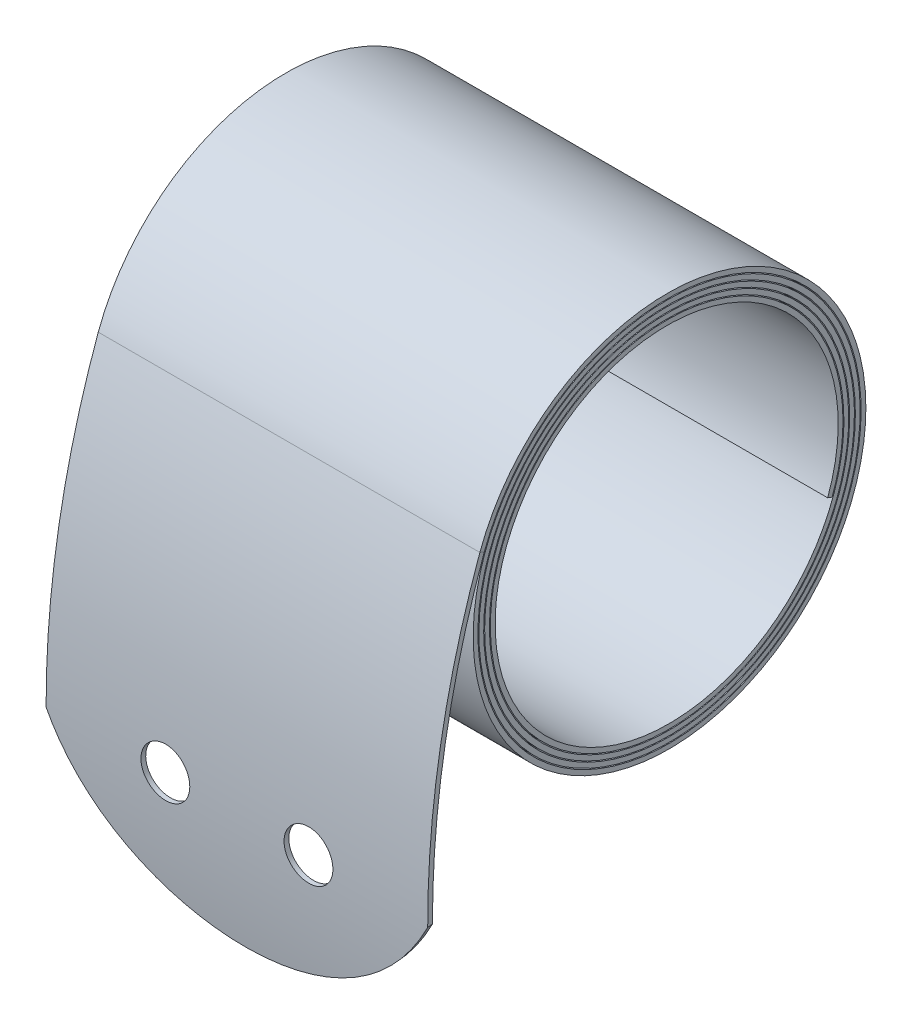
from build123d import *

# Parameters (mm, degrees)
SWEEP1_START            = -25.4
SWEEP1_DEPTH            = 50.8
CUT_EXTRUDE1_START      = -32.004
SKETCH7_R               = 3.2512
CUT_EXTRUDE1_DEPTH      = 0.681175
CUT_EXTRUDE2_REACH      = 81.314
CUT_EXTRUDE2_END_RADIUS = 114.481887753


# Read off the part's stored shape, not the designer's step: Sweep1
with BuildPart() as part:
    # Sweep1 outline → Sweep1 (new body)
    with BuildSketch(Plane.YZ.offset(SWEEP1_START)):
        with BuildLine():
            add(Edge.make_bspline(
                [(8.903137724, 24.465391141), (10.700868747, 23.801683687), (12.424511347, 22.938788454), (16.844541654, 20.077476403), (19.297827534, 17.707835933), (23.129543349, 12.223133684), (24.505684338, 9.109523574), (25.983668908, 2.59633953), (26.084861672, -0.800173821), (24.999673041, -7.377666567), (23.814808706, -10.556407395), (20.337047387, -16.22878679), (18.044903236, -18.721294308), (12.694684995, -22.657644037), (9.637997127, -24.099180397), (3.209844587, -25.724504821), (-0.15859242, -25.907571307), (-6.71284624, -24.990609709), (-9.896404372, -23.892031774), (-15.610508884, -20.578578721), (-18.139923082, -18.364418644), (-22.176631417, -13.150492998), (-23.681604623, -10.152048253), (-25.450992962, -3.812207553), (-25.714616983, -0.473804723), (-24.964084289, 6.052944065), (-23.951310748, 9.239013154), (-20.802104637, 14.990220244), (-18.666349722, 17.55422609), (-13.590396859, 21.686992551), (-10.651454439, 23.25341896), (-4.403096531, 25.163523714), (-1.09663805, 25.506342667), (5.398413944, 24.920333403), (8.584714317, 23.992821371), (14.368429935, 21.007673594), (16.964714197, 18.950678553), (21.189216843, 14.01425013), (22.815089545, 11.136007128), (24.862495039, 4.982192063), (25.283101453, 1.709539351), (24.859605366, -4.749701113), (24.016752103, -7.933981359), (21.195348133, -13.745643394), (19.217401652, -16.371896492), (14.421920767, -20.683795633), (11.605511793, -22.367086297), (5.5491873, -24.548312104), (2.312151981, -25.045255211), (-4.107241841, -24.782159903), (-7.287280367, -24.023303873), (-13.122362044, -21.365204732), (-15.776279894, -19.46652987), (-20.171221783, -14.813291139), (-21.90988251, -12.059787994), (-24.2213869, -6.103788165), (-24.793174231, -2.904131072), (-24.688267859, 3.47146314), (-24.012689834, 6.645069692), (-21.51733364, 12.499082915), (-19.698088278, 15.17836875), (-15.188258015, 19.651989265), (-12.498669425, 21.443954445), (-6.645713494, 23.882137863), (-3.485143725, 24.527236864), (2.842782484, 24.578210899), (6.007799632, 23.985135102), (11.876298275, 21.651838714), (14.57866445, 19.912116051), (19.126592756, 15.546732552), (20.969780926, 12.922003952), (23.530989486, 7.174695183), (24.247829157, 4.054869198), (24.452281203, -2.221607538), (23.940876488, -5.375912123), (21.76883723, -11.254495262), (20.108666337, -13.977665036), (15.888640263, -18.595527226), (13.329653632, -20.487842928), (7.690478305, -23.168371932), (4.612999083, -23.955344486), (-1.608335891, -24.310781156), (-4.749840436, -23.880162221), (-10.634155519, -21.868459702), (-13.375864819, -20.287806109), (-18.059287537, -16.21392098), (-19.998623169, -13.72149473), (-22.794720642, -8.192821232), (-23.650183182, -5.159237469), (-24.154023026, 1.003354808), (-23.803251669, 4.130008885), (-21.950849674, 10.015754847), (-20.449616024, 12.773754006), (-16.522528795, 17.518368034), (-14.097417718, 19.502605709), (-8.681495737, 22.410475943), (-5.693301097, 23.332752155), (0.407040981, 23.982328643), (3.516832544, 23.710415046), (9.399762849, 22.016163517), (12.171818322, 20.594190248), (16.97326215, 16.814432007), (19.000275539, 14.457327266), (22.016082652, 9.156287084), (23.003464514, 6.214919501), (23.796029065, 0.180239702), (23.601933114, -2.910716972), (22.064570208, -8.786642595), (20.721636296, -11.570538649), (17.089613041, -16.424462003), (14.801142218, -18.492118178), (9.616994114, -21.611989681), (6.723835142, -22.662739187), (0.758132384, -23.595464243), (-2.312057945, -23.478096881), (-8.176850283, -22.096251102), (-10.97039066, -20.832074841), (-15.872458002, -17.348068366), (-17.97861927, -15.128795563), (-21.198649639, -10.06342931), (-22.311000533, -7.21980353), (-23.380982678, -1.326293449), (-23.339207286, 1.721241201), (-22.111399698, 7.570834914), (-20.925639525, 10.371844468), (-17.5898084, 15.317738459), (-15.440234387, 17.460264188), (-10.49541886, 20.776518431), (-7.70259333, 21.948677955), (-1.884390732, 23.152941076), (1.13864219, 23.185574885), (6.969037975, 22.110221394), (9.775364276, 21.002476761), (14.760789197, 17.8148574), (16.937537627, 15.73541982), (20.346054864, 10.912802703), (21.57620551, 8.171986465), (22.911703992, 2.432103709), (23.017519524, -0.564625841), (22.092933231, -6.371893121), (21.062745519, -9.181408033), (18.023253351, -14.202093166), (16.014326971, -16.410923215), (11.315434562, -19.90772024), (8.6277782, -21.194021522), (2.969123682, -22.65764348), (0.000453671, -22.835370014), (-4.541194543, -22.225965003), (-6.167621007, -21.821223556), (-7.728596637, -21.243832796)],
                knots=[1.961e-06, 1.961e-06, 1.961e-06, 1.961e-06, 0.0078125, 0.0078125, 0.021484375, 0.021484375, 0.03515625, 0.03515625, 0.048828125, 0.048828125, 0.0625, 0.0625, 0.076171875, 0.076171875, 0.08984375, 0.08984375, 0.103515625, 0.103515625, 0.1171875, 0.1171875, 0.130859375, 0.130859375, 0.14453125, 0.14453125, 0.158203125, 0.158203125, 0.171875, 0.171875, 0.185546875, 0.185546875, 0.19921875, 0.19921875, 0.212890625, 0.212890625, 0.2265625, 0.2265625, 0.240234375, 0.240234375, 0.25390625, 0.25390625, 0.267578125, 0.267578125, 0.28125, 0.28125, 0.294921875, 0.294921875, 0.30859375, 0.30859375, 0.322265625, 0.322265625, 0.3359375, 0.3359375, 0.349609375, 0.349609375, 0.36328125, 0.36328125, 0.376953125, 0.376953125, 0.390625, 0.390625, 0.404296875, 0.404296875, 0.41796875, 0.41796875, 0.431640625, 0.431640625, 0.4453125, 0.4453125, 0.458984375, 0.458984375, 0.47265625, 0.47265625, 0.486328125, 0.486328125, 0.5, 0.5, 0.513671875, 0.513671875, 0.52734375, 0.52734375, 0.541015625, 0.541015625, 0.5546875, 0.5546875, 0.568359375, 0.568359375, 0.58203125, 0.58203125, 0.595703125, 0.595703125, 0.609375, 0.609375, 0.623046875, 0.623046875, 0.63671875, 0.63671875, 0.650390625, 0.650390625, 0.6640625, 0.6640625, 0.677734375, 0.677734375, 0.69140625, 0.69140625, 0.705078125, 0.705078125, 0.71875, 0.71875, 0.732421875, 0.732421875, 0.74609375, 0.74609375, 0.759765625, 0.759765625, 0.7734375, 0.7734375, 0.787109375, 0.787109375, 0.80078125, 0.80078125, 0.814453125, 0.814453125, 0.828125, 0.828125, 0.841796875, 0.841796875, 0.85546875, 0.85546875, 0.869140625, 0.869140625, 0.8828125, 0.8828125, 0.896484375, 0.896484375, 0.91015625, 0.91015625, 0.923828125, 0.923828125, 0.9375, 0.9375, 0.951171875, 0.951171875, 0.96484375, 0.96484375, 0.978515625, 0.978515625, 0.9921875, 0.9921875, 1, 1, 1, 1], degree=3))
            Line((-7.728596637, -21.243832796), (-7.948890151, -21.8393962))
            add(Edge.make_bspline(
                [(9.121677222, 25.061602196), (10.963935862, 24.381572113), (12.729773162, 23.497617115), (17.2585819, 20.56588724), (19.771540153, 18.138544407), (23.696930402, 12.519756958), (25.106870014, 9.32967994), (26.620995771, 2.657228873), (26.724704836, -0.82284976), (25.612890165, -7.561726968), (24.399103381, -10.818274169), (20.8354592, -16.630732234), (18.487092507, -19.184308442), (13.005125158, -23.21759077), (9.872821691, -24.694789724), (3.286335698, -26.360147925), (-0.165579843, -26.547778034), (-6.881822266, -25.608153699), (-10.143872272, -24.482568917), (-16.000118279, -21.086691895), (-18.591960772, -18.817822846), (-22.728801579, -13.474563292), (-24.271279892, -10.401399667), (-26.084570478, -3.904254183), (-26.354802663, -0.482509715), (-25.585584076, 6.206734492), (-24.547735478, 9.471933792), (-21.319613743, 15.367259775), (-19.130696262, 17.995015993), (-13.927902339, 22.231054586), (-10.915182628, 23.83680605), (-4.510643083, 25.794655074), (-1.121029922, 26.146122725), (5.536926685, 25.545415562), (8.802948057, 24.594775291), (14.732673356, 21.534267572), (17.393991745, 19.425688276), (21.724844088, 14.364987789), (23.391838137, 11.413953384), (25.49080117, 5.105173626), (25.922091581, 1.749603139), (25.487894341, -4.872853268), (24.62387351, -8.137397403), (21.730710481, -14.096872163), (19.702789013, -16.789404056), (14.785679656, -21.210666515), (11.897508871, -22.936850081), (5.68752969, -25.173415652), (2.367863302, -25.683071598), (-4.214959749, -25.413278233), (-7.475756832, -24.635227983), (-13.460365457, -21.909013695), (-16.181766932, -19.9620031), (-20.689020012, -15.189852492), (-22.472319397, -12.365660214), (-24.842912462, -6.257407966), (-25.429433796, -2.975456136), (-25.321836405, 3.563682423), (-24.629048998, 6.818493683), (-22.069262408, 12.82365823), (-20.203349564, 15.571591965), (-15.577395388, 20.160404026), (-12.818232777, 21.998726774), (-6.814518115, 24.499712209), (-3.572039362, 25.161557486), (2.919448084, 25.213849074), (6.166067309, 24.605559027), (12.187250836, 22.211555615), (14.95938793, 20.426861717), (19.625318891, 15.948211954), (21.516555661, 13.255066208), (24.144241784, 7.358582908), (24.879829905, 4.15728288), (25.0896072, -2.282673748), (24.564992462, -5.518928762), (22.336005934, -11.551638612), (20.632587024, -14.345660397), (16.302220301, -19.084265423), (13.676014464, -21.026291863), (7.889338363, -23.776933974), (4.730868959, -24.584645849), (-1.653766384, -24.949412179), (-4.877520486, -24.507595339), (-10.917311515, -22.442739421), (-13.730911345, -20.820586967), (-18.537744507, -16.639353002), (-20.528423126, -14.080945829), (-23.398227063, -8.406533858), (-24.276407296, -5.292492401), (-24.793575521, 1.033122658), (-24.433625057, 4.242276021), (-22.53189537, 10.284753764), (-20.990936895, 13.115638776), (-16.959557045, 17.986256687), (-14.469742922, 20.023438729), (-8.909932248, 23.008564441), (-5.841860705, 23.955523033), (0.421128678, 24.622418528), (3.613619708, 24.343350088), (9.654443484, 22.60362611), (12.500336343, 21.143725868), (17.430301768, 17.262793775), (19.511829074, 14.84230269), (22.608394208, 9.399309956), (23.62240827, 6.378694212), (24.436271962, 0.181840245), (24.237049683, -2.991966415), (22.658096784, -9.02685236), (21.279056483, -11.885492975), (17.549038826, -16.870378408), (15.19853639, -18.994085282), (9.874457065, -22.198168775), (6.902726247, -23.277484262), (0.77541982, -24.235475711), (-2.37772126, -24.115013565), (-8.402445301, -22.695485131), (-11.271592513, -21.397044699), (-16.306983724, -17.818282036), (-18.47069878, -15.538369565), (-21.77834446, -10.335177393), (-22.921177919, -7.413703239), (-24.020378442, -1.359257008), (-23.97754162, 1.771279353), (-22.715981244, 7.781680102), (-21.497819649, 10.659113347), (-18.070527359, 15.740612891), (-15.861741998, 17.942160905), (-10.781288552, 21.349381095), (-7.911384844, 22.553921417), (-1.933010221, 23.791337262), (1.173025538, 23.82494358), (7.165007123, 22.719787335), (10.048528068, 21.581523435), (15.171758755, 18.305792763), (17.408962495, 16.168607667), (20.911741616, 11.212622008), (22.176151809, 8.395544042), (23.548717356, 2.496349528), (23.657538702, -0.583334154), (22.70711748, -6.552868969), (21.648310929, -9.440303117), (18.524110114, -14.600911441), (16.45893468, -16.871593496), (11.629023114, -20.465891669), (8.865967236, -21.788310627), (3.048956842, -23.292891639), (-0.002568797, -23.475655434), (-4.67217203, -22.849081232), (-6.343886012, -22.433072707), (-7.948890151, -21.8393962)],
                knots=[0, 0, 0, 0, 0.0078125, 0.0078125, 0.021484375, 0.021484375, 0.03515625, 0.03515625, 0.048828125, 0.048828125, 0.0625, 0.0625, 0.076171875, 0.076171875, 0.08984375, 0.08984375, 0.103515625, 0.103515625, 0.1171875, 0.1171875, 0.130859375, 0.130859375, 0.14453125, 0.14453125, 0.158203125, 0.158203125, 0.171875, 0.171875, 0.185546875, 0.185546875, 0.19921875, 0.19921875, 0.212890625, 0.212890625, 0.2265625, 0.2265625, 0.240234375, 0.240234375, 0.25390625, 0.25390625, 0.267578125, 0.267578125, 0.28125, 0.28125, 0.294921875, 0.294921875, 0.30859375, 0.30859375, 0.322265625, 0.322265625, 0.3359375, 0.3359375, 0.349609375, 0.349609375, 0.36328125, 0.36328125, 0.376953125, 0.376953125, 0.390625, 0.390625, 0.404296875, 0.404296875, 0.41796875, 0.41796875, 0.431640625, 0.431640625, 0.4453125, 0.4453125, 0.458984375, 0.458984375, 0.47265625, 0.47265625, 0.486328125, 0.486328125, 0.5, 0.5, 0.513671875, 0.513671875, 0.52734375, 0.52734375, 0.541015625, 0.541015625, 0.5546875, 0.5546875, 0.568359375, 0.568359375, 0.58203125, 0.58203125, 0.595703125, 0.595703125, 0.609375, 0.609375, 0.623046875, 0.623046875, 0.63671875, 0.63671875, 0.650390625, 0.650390625, 0.6640625, 0.6640625, 0.677734375, 0.677734375, 0.69140625, 0.69140625, 0.705078125, 0.705078125, 0.71875, 0.71875, 0.732421875, 0.732421875, 0.74609375, 0.74609375, 0.759765625, 0.759765625, 0.7734375, 0.7734375, 0.787109375, 0.787109375, 0.80078125, 0.80078125, 0.814453125, 0.814453125, 0.828125, 0.828125, 0.841796875, 0.841796875, 0.85546875, 0.85546875, 0.869140625, 0.869140625, 0.8828125, 0.8828125, 0.896484375, 0.896484375, 0.91015625, 0.91015625, 0.923828125, 0.923828125, 0.9375, 0.9375, 0.951171875, 0.951171875, 0.96484375, 0.96484375, 0.978515625, 0.978515625, 0.9921875, 0.9921875, 1, 1, 1, 1], degree=3))
            ThreePointArc((9.121677222, 25.061602196), (-18.144233847, 31.365640048), (-46.125617226, 30.90413826))
            Line((-46.125617226, 30.90413826), (-46.038048623, 30.275205243))
            ThreePointArc((-46.038048623, 30.275205243), (-18.21173214, 30.734237241), (8.903137724, 24.465391141))
        make_face()
    extrude(amount=SWEEP1_DEPTH)

    # Sketch7 → Cut-Extrude1 (cut)
    with BuildSketch(Plane(origin=(0, -4.268002453, 0), x_dir=(1, 0, 0), z_dir=(0, 0, -1)).offset(CUT_EXTRUDE1_START)):
        with Locations((-9.525, 25.982614773)):
            Circle(SKETCH7_R)
        with Locations((9.525, 25.982614773)):
            Circle(SKETCH7_R)
    extrude(amount=CUT_EXTRUDE1_DEPTH, mode=Mode.SUBTRACT)

    # Cut-Extrude2: up to this cylinder (the profile starts outside it)
    cut_extrude2_end = Plane(origin=(24.86818, -30.250617226, -83.112887753), z_dir=(-1, 0, 0)) * Cylinder(CUT_EXTRUDE2_END_RADIUS, 392.591775505, mode=Mode.PRIVATE)
    # Sketch8 → Cut-Extrude2 (cut, up to the surface)
    with BuildSketch(Plane(origin=(0, -5.0982504, 36.616525885), x_dir=(1, 0, 0), z_dir=(0, -0.137903311233731, 0.9904456960130489)), mode=Mode.PRIVATE) as cut_extrude2_sk1:
        with BuildLine():
            Line((25.4, -41.42313606), (25.4, -25.938996422))
            ThreePointArc((25.4, -25.938996422), (0, -41.42313606), (-25.4, -25.938996422))
            Line((-25.4, -25.938996422), (-25.4, -41.42313606))
            Line((-25.4, -41.42313606), (-25.4, -41.67713606))
            Line((-25.4, -41.67713606), (25.4, -41.67713606))
            Line((25.4, -41.67713606), (25.4, -41.42313606))
        make_face()
    cut_extrude2_tool1 = extrude(cut_extrude2_sk1.sketch, amount=-CUT_EXTRUDE2_REACH, mode=Mode.PRIVATE) - cut_extrude2_end
    add(cut_extrude2_tool1.solids().sort_by_distance((24.86818, -38.457517, 31.971795))[0], mode=Mode.SUBTRACT)


solid = part.part
